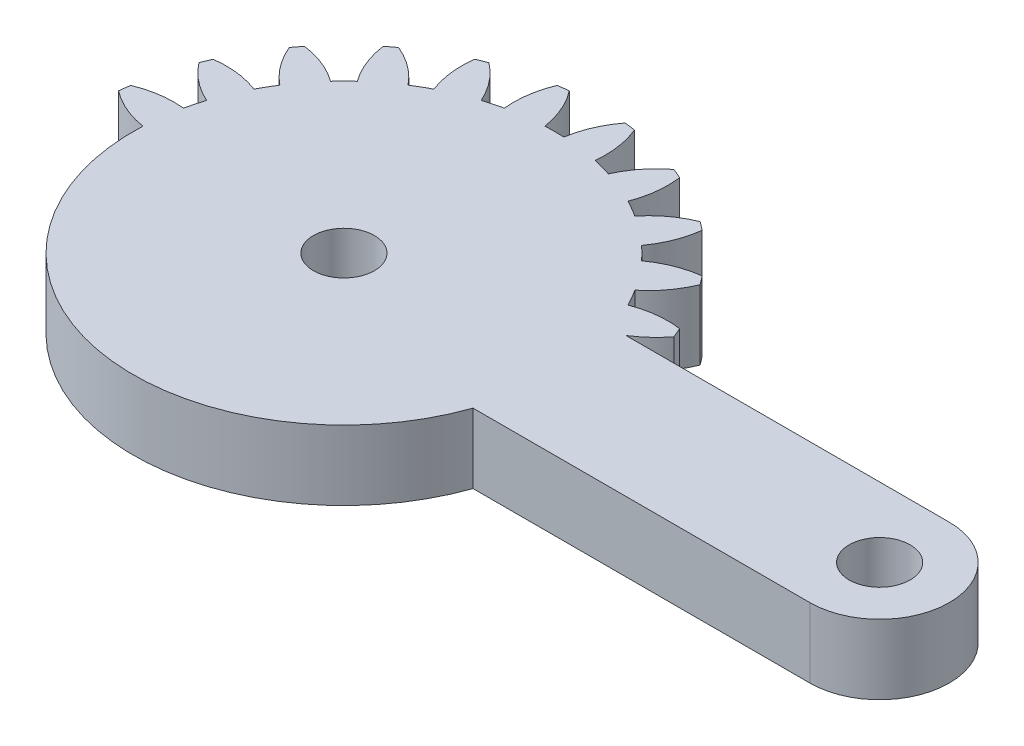
from build123d import *
from build123d.topology import SkipClean

# Parameters (mm, degrees)
SKETCH1_R           = 1.75
BOSS_EXTRUDE1_DEPTH = 4
CUT_EXTRUDE1_START  = -10
CUT_EXTRUDE1_DEPTH  = 10


with BuildPart() as part:
    # Sketch1 → Boss-Extrude1 (new body)
    with BuildSketch(Plane(origin=(0, 0, 0), x_dir=(1, 0, 0), z_dir=(0, 1, 0))):
        with BuildLine():
            Line((20.643657446, 4), (2.081641936, 4))
            ThreePointArc((2.081641936, 4), (2.861028333, 4.588201733), (3.521749436, 5.30713988))
            ThreePointArc((3.521749436, 5.30713988), (3.405395609, 5.596745198), (3.282888305, 5.883801663))
            ThreePointArc((3.282888305, 5.883801663), (1.93527598, 5.894040025), (0.627094961, 5.57027124))
            ThreePointArc((0.627094961, 5.57027124), (0.366286148, 6.046375), (0.084372603, 6.510293938))
            ThreePointArc((0.084372603, 6.510293938), (1.018855105, 7.48132754), (1.683794586, 8.65351323))
            ThreePointArc((1.683794586, 8.65351323), (1.496450048, 8.903135899), (1.303821399, 9.148703928))
            ThreePointArc((1.303821399, 9.148703928), (-0.000522033, 8.809805691), (-1.180330337, 8.158486898))
            ThreePointArc((-1.180330337, 8.158486898), (-1.555477026, 8.550865528), (-1.947855656, 8.926012217))
            ThreePointArc((-1.947855656, 8.926012217), (-1.296536862, 10.105820521), (-0.957638625, 11.410163953))
            ThreePointArc((-0.957638625, 11.410163953), (-1.203206655, 11.602792602), (-1.452829324, 11.79013714))
            ThreePointArc((-1.452829324, 11.79013714), (-2.625015014, 11.125197659), (-3.596048616, 10.190715157))
            ThreePointArc((-3.596048616, 10.190715157), (-4.059967554, 10.472628702), (-4.536071314, 10.733437515))
            ThreePointArc((-4.536071314, 10.733437515), (-4.212302529, 12.041618533), (-4.222540891, 13.389230859))
            ThreePointArc((-4.222540891, 13.389230859), (-4.509597355, 13.511738163), (-4.799202674, 13.62809199))
            ThreePointArc((-4.799202674, 13.62809199), (-5.759348103, 12.682425791), (-6.455432668, 11.528463019))
            ThreePointArc((-6.455432668, 11.528463019), (-6.976508546, 11.680699536), (-7.503891752, 11.809396783))
            ThreePointArc((-7.503891752, 11.809396783), (-7.529737283, 13.156800143), (-7.888414517, 14.455843809))
            ThreePointArc((-7.888414517, 14.455843809), (-8.197396993, 14.499881098), (-8.507248835, 14.537314892))
            ThreePointArc((-8.507248835, 14.537314892), (-9.18992168, 13.375367565), (-9.563620196, 12.080565177))
            ThreePointArc((-9.563620196, 12.080565177), (-10.106342554, 12.09275), (-10.649064912, 12.080565177))
            ThreePointArc((-10.649064912, 12.080565177), (-11.022763428, 13.375367565), (-11.705436272, 14.537314892))
            ThreePointArc((-11.705436272, 14.537314892), (-12.015288115, 14.499881098), (-12.324270591, 14.455843809))
            ThreePointArc((-12.324270591, 14.455843809), (-12.682947825, 13.156800143), (-12.708793355, 11.809396783))
            ThreePointArc((-12.708793355, 11.809396783), (-13.236176561, 11.680699536), (-13.757252439, 11.528463019))
            ThreePointArc((-13.757252439, 11.528463019), (-14.453337005, 12.682425791), (-15.413482434, 13.62809199))
            ThreePointArc((-15.413482434, 13.62809199), (-15.703087752, 13.511738163), (-15.990144217, 13.389230859))
            ThreePointArc((-15.990144217, 13.389230859), (-16.000382579, 12.041618533), (-15.676613793, 10.733437515))
            ThreePointArc((-15.676613793, 10.733437515), (-16.152717554, 10.472628702), (-16.616636492, 10.190715157))
            ThreePointArc((-16.616636492, 10.190715157), (-17.587670094, 11.125197659), (-18.759855783, 11.79013714))
            ThreePointArc((-18.759855783, 11.79013714), (-19.009478453, 11.602792602), (-19.255046482, 11.410163953))
            ThreePointArc((-19.255046482, 11.410163953), (-18.916148245, 10.105820521), (-18.264829452, 8.926012217))
            ThreePointArc((-18.264829452, 8.926012217), (-18.657208082, 8.550865528), (-19.032354771, 8.158486898))
            ThreePointArc((-19.032354771, 8.158486898), (-20.212163074, 8.809805691), (-21.516506507, 9.148703928))
            ThreePointArc((-21.516506507, 9.148703928), (-21.709135156, 8.903135899), (-21.896479694, 8.65351323))
            ThreePointArc((-21.896479694, 8.65351323), (-21.231540213, 7.48132754), (-20.297057711, 6.510293938))
            ThreePointArc((-20.297057711, 6.510293938), (-20.578971255, 6.046375), (-20.839780068, 5.57027124))
            ThreePointArc((-20.839780068, 5.57027124), (-22.147961087, 5.894040025), (-23.495573413, 5.883801663))
            ThreePointArc((-23.495573413, 5.883801663), (-23.618080717, 5.596745198), (-23.734434544, 5.30713988))
            ThreePointArc((-23.734434544, 5.30713988), (-22.788768345, 4.346994451), (-21.634805572, 3.650909885))
            ThreePointArc((-21.634805572, 3.650909885), (-21.78704209, 3.129834008), (-21.915739337, 2.602450802))
            ThreePointArc((-21.915739337, 2.602450802), (-23.263142697, 2.576605271), (-24.562186363, 2.217928037))
            ThreePointArc((-24.562186363, 2.217928037), (-24.606223651, 1.908945561), (-24.643657446, 1.599093719))
            ThreePointArc((-24.643657446, 1.599093719), (-23.481710119, 0.916420874), (-22.186907731, 0.542722358))
            ThreePointArc((-22.186907731, 0.542722358), (-22.199092554, 0), (-22.186907731, -0.542722358))
            ThreePointArc((-22.186907731, -0.542722358), (-23.481710119, -0.916420874), (-24.643657446, -1.599093719))
            ThreePointArc((-24.643657446, -1.599093719), (-24.606223651, -1.908945561), (-24.562186363, -2.217928037))
            ThreePointArc((-24.562186363, -2.217928037), (-23.263142697, -2.576605271), (-21.915739337, -2.602450802))
            ThreePointArc((-21.915739337, -2.602450802), (-21.78704209, -3.129834008), (-21.634805572, -3.650909885))
            ThreePointArc((-21.634805572, -3.650909885), (-22.788768345, -4.346994451), (-23.734434544, -5.30713988))
            ThreePointArc((-23.734434544, -5.30713988), (-23.618080717, -5.596745198), (-23.495573413, -5.883801663))
            ThreePointArc((-23.495573413, -5.883801663), (-22.147961087, -5.894040025), (-20.839780068, -5.57027124))
            ThreePointArc((-20.839780068, -5.57027124), (-20.578971255, -6.046375), (-20.297057711, -6.510293938))
            ThreePointArc((-20.297057711, -6.510293938), (-21.231540213, -7.48132754), (-21.896479694, -8.65351323))
            ThreePointArc((-21.896479694, -8.65351323), (-21.709135156, -8.903135899), (-21.516506507, -9.148703928))
            ThreePointArc((-21.516506507, -9.148703928), (-20.212163074, -8.809805691), (-19.032354771, -8.158486898))
            ThreePointArc((-19.032354771, -8.158486898), (-18.657208082, -8.550865528), (-18.264829452, -8.926012217))
            ThreePointArc((-18.264829452, -8.926012217), (-18.916148245, -10.105820521), (-19.255046482, -11.410163953))
            ThreePointArc((-19.255046482, -11.410163953), (-19.009478453, -11.602792602), (-18.759855783, -11.79013714))
            ThreePointArc((-18.759855783, -11.79013714), (-17.587670094, -11.125197659), (-16.616636492, -10.190715157))
            ThreePointArc((-16.616636492, -10.190715157), (-16.152717554, -10.472628702), (-15.676613793, -10.733437515))
            ThreePointArc((-15.676613793, -10.733437515), (-16.000382579, -12.041618533), (-15.990144217, -13.389230859))
            ThreePointArc((-15.990144217, -13.389230859), (-15.703087752, -13.511738163), (-15.413482434, -13.62809199))
            ThreePointArc((-15.413482434, -13.62809199), (-14.453337005, -12.682425791), (-13.757252439, -11.528463019))
            ThreePointArc((-13.757252439, -11.528463019), (-13.236176561, -11.680699536), (-12.708793355, -11.809396783))
            ThreePointArc((-12.708793355, -11.809396783), (-12.682947825, -13.156800143), (-12.324270591, -14.455843809))
            ThreePointArc((-12.324270591, -14.455843809), (-12.015288115, -14.499881098), (-11.705436272, -14.537314892))
            ThreePointArc((-11.705436272, -14.537314892), (-11.022763428, -13.375367565), (-10.649064912, -12.080565177))
            ThreePointArc((-10.649064912, -12.080565177), (-10.106342554, -12.09275), (-9.563620196, -12.080565177))
            ThreePointArc((-9.563620196, -12.080565177), (-9.18992168, -13.375367565), (-8.507248835, -14.537314892))
            ThreePointArc((-8.507248835, -14.537314892), (-8.197396993, -14.499881098), (-7.888414517, -14.455843809))
            ThreePointArc((-7.888414517, -14.455843809), (-7.529737283, -13.156800143), (-7.503891752, -11.809396783))
            ThreePointArc((-7.503891752, -11.809396783), (-6.976508546, -11.680699536), (-6.455432668, -11.528463019))
            ThreePointArc((-6.455432668, -11.528463019), (-5.759348103, -12.682425791), (-4.799202674, -13.62809199))
            ThreePointArc((-4.799202674, -13.62809199), (-4.509597355, -13.511738163), (-4.222540891, -13.389230859))
            ThreePointArc((-4.222540891, -13.389230859), (-4.212302529, -12.041618533), (-4.536071314, -10.733437515))
            ThreePointArc((-4.536071314, -10.733437515), (-4.059967554, -10.472628702), (-3.596048616, -10.190715157))
            ThreePointArc((-3.596048616, -10.190715157), (-2.625015014, -11.125197659), (-1.452829324, -11.79013714))
            ThreePointArc((-1.452829324, -11.79013714), (-1.203206655, -11.602792602), (-0.957638625, -11.410163953))
            ThreePointArc((-0.957638625, -11.410163953), (-1.296536862, -10.105820521), (-1.947855656, -8.926012217))
            ThreePointArc((-1.947855656, -8.926012217), (-1.555477026, -8.550865528), (-1.180330337, -8.158486898))
            ThreePointArc((-1.180330337, -8.158486898), (-0.000522033, -8.809805691), (1.303821399, -9.148703928))
            ThreePointArc((1.303821399, -9.148703928), (1.496450048, -8.903135899), (1.683794586, -8.65351323))
            ThreePointArc((1.683794586, -8.65351323), (1.018855105, -7.48132754), (0.084372603, -6.510293938))
            ThreePointArc((0.084372603, -6.510293938), (0.366286148, -6.046375), (0.627094961, -5.57027124))
            ThreePointArc((0.627094961, -5.57027124), (1.93527598, -5.894040025), (3.282888305, -5.883801663))
            ThreePointArc((3.282888305, -5.883801663), (3.405395609, -5.596745198), (3.521749436, -5.30713988))
            ThreePointArc((3.521749436, -5.30713988), (2.861028333, -4.588201733), (2.081641936, -4))
            Line((2.081641936, -4), (20.643657446, -4))
            ThreePointArc((20.643657446, -4), (24.643657446, 0), (20.643657446, 4))
        make_face()
        with Locations((-10.106342554, 0)):
            Circle(SKETCH1_R, mode=Mode.SUBTRACT)
        with Locations((20.643657446, 0)):
            Circle(SKETCH1_R, mode=Mode.SUBTRACT)
    extrude(amount=BOSS_EXTRUDE1_DEPTH)

    # Sketch2 → Cut-Extrude1 (cut)
    with SkipClean():  # the faces are left unmerged after this step: merging them gives an invalid solid
        with BuildSketch(Plane(origin=(0, 4, 0), x_dir=(1, 0, 0), z_dir=(0, 1, 0)).offset(CUT_EXTRUDE1_START)):
            with BuildLine():
                ThreePointArc((-24.562186363, -2.217928037), (-23.263142697, -2.576605271), (-21.915739337, -2.602450802))
                ThreePointArc((-21.915739337, -2.602450802), (-22.095637401, -1.578420611), (-22.186907731, -0.542722358))
                ThreePointArc((-22.186907731, -0.542722358), (-23.481710119, -0.916420874), (-24.643657446, -1.599093719))
                ThreePointArc((-24.643657446, -1.599093719), (-24.606223651, -1.908945561), (-24.562186363, -2.217928037))
            make_face()
            with BuildLine():
                ThreePointArc((-23.495573413, -5.883801663), (-22.147961087, -5.894040025), (-20.839780068, -5.57027124))
                ThreePointArc((-20.839780068, -5.57027124), (-21.278586771, -4.627695077), (-21.634805572, -3.650909885))
                ThreePointArc((-21.634805572, -3.650909885), (-22.788768345, -4.346994451), (-23.734434544, -5.30713988))
                ThreePointArc((-23.734434544, -5.30713988), (-23.618080717, -5.596745198), (-23.495573413, -5.883801663))
            make_face()
            with BuildLine():
                ThreePointArc((-21.516506507, -9.148703928), (-20.212163074, -8.809805691), (-19.032354771, -8.158486898))
                ThreePointArc((-19.032354771, -8.158486898), (-19.70016616, -7.361599771), (-20.297057711, -6.510293938))
                ThreePointArc((-20.297057711, -6.510293938), (-21.231540213, -7.48132754), (-21.896479694, -8.65351323))
                ThreePointArc((-21.896479694, -8.65351323), (-21.709135156, -8.903135899), (-21.516506507, -9.148703928))
            make_face()
            with BuildLine():
                ThreePointArc((-18.759855783, -11.79013714), (-17.587670094, -11.125197659), (-16.616636492, -10.190715157))
                ThreePointArc((-16.616636492, -10.190715157), (-17.467942324, -9.593823606), (-18.264829452, -8.926012217))
                ThreePointArc((-18.264829452, -8.926012217), (-18.916148245, -10.105820521), (-19.255046482, -11.410163953))
                ThreePointArc((-19.255046482, -11.410163953), (-19.009478453, -11.602792602), (-18.759855783, -11.79013714))
            make_face()
            with BuildLine():
                ThreePointArc((-15.413482434, -13.62809199), (-14.453337005, -12.682425791), (-13.757252439, -11.528463019))
                ThreePointArc((-13.757252439, -11.528463019), (-14.734037631, -11.172244217), (-15.676613793, -10.733437515))
                ThreePointArc((-15.676613793, -10.733437515), (-16.000382579, -12.041618533), (-15.990144217, -13.389230859))
                ThreePointArc((-15.990144217, -13.389230859), (-15.703087752, -13.511738163), (-15.413482434, -13.62809199))
            make_face()
            with BuildLine():
                ThreePointArc((-11.705436272, -14.537314892), (-11.022763428, -13.375367565), (-10.649064912, -12.080565177))
                ThreePointArc((-10.649064912, -12.080565177), (-11.684763165, -11.989294847), (-12.708793355, -11.809396783))
                ThreePointArc((-12.708793355, -11.809396783), (-12.682947825, -13.156800143), (-12.324270591, -14.455843809))
                ThreePointArc((-12.324270591, -14.455843809), (-12.015288115, -14.499881098), (-11.705436272, -14.537314892))
            make_face()
            with BuildLine():
                ThreePointArc((-7.888414517, -14.455843809), (-7.529737283, -13.156800143), (-7.503891752, -11.809396783))
                ThreePointArc((-7.503891752, -11.809396783), (-8.527921943, -11.989294847), (-9.563620196, -12.080565177))
                ThreePointArc((-9.563620196, -12.080565177), (-9.18992168, -13.375367565), (-8.507248835, -14.537314892))
                ThreePointArc((-8.507248835, -14.537314892), (-8.197396993, -14.499881098), (-7.888414517, -14.455843809))
            make_face()
            with BuildLine():
                ThreePointArc((-4.222540891, -13.389230859), (-4.212302529, -12.041618533), (-4.536071314, -10.733437515))
                ThreePointArc((-4.536071314, -10.733437515), (-5.478647477, -11.172244217), (-6.455432668, -11.528463019))
                ThreePointArc((-6.455432668, -11.528463019), (-5.759348103, -12.682425791), (-4.799202674, -13.62809199))
                ThreePointArc((-4.799202674, -13.62809199), (-4.509597355, -13.511738163), (-4.222540891, -13.389230859))
            make_face()
            with BuildLine():
                ThreePointArc((-0.957638625, -11.410163953), (-1.296536862, -10.105820521), (-1.947855656, -8.926012217))
                ThreePointArc((-1.947855656, -8.926012217), (-2.744742783, -9.593823606), (-3.596048616, -10.190715157))
                ThreePointArc((-3.596048616, -10.190715157), (-2.625015014, -11.125197659), (-1.452829324, -11.79013714))
                ThreePointArc((-1.452829324, -11.79013714), (-1.203206655, -11.602792602), (-0.957638625, -11.410163953))
            make_face()
            with BuildLine():
                ThreePointArc((1.683794586, -8.65351323), (1.018855105, -7.48132754), (0.084372603, -6.510293938))
                ThreePointArc((0.084372603, -6.510293938), (-0.512518948, -7.361599771), (-1.180330337, -8.158486898))
                ThreePointArc((-1.180330337, -8.158486898), (-0.000522033, -8.809805691), (1.303821399, -9.148703928))
                ThreePointArc((1.303821399, -9.148703928), (1.496450048, -8.903135899), (1.683794586, -8.65351323))
            make_face()
            with BuildLine():
                ThreePointArc((3.521749436, -5.30713988), (2.861028333, -4.588201733), (2.081641936, -4))
                Line((2.081641936, -4), (1.305695063, -4))
                ThreePointArc((1.305695063, -4), (0.994195953, -4.797149927), (0.627094961, -5.57027124))
                ThreePointArc((0.627094961, -5.57027124), (1.93527598, -5.894040025), (3.282888305, -5.883801663))
                ThreePointArc((3.282888305, -5.883801663), (3.405395609, -5.596745198), (3.521749436, -5.30713988))
            make_face()
        extrude(amount=CUT_EXTRUDE1_DEPTH, mode=Mode.SUBTRACT)


solid = part.part
